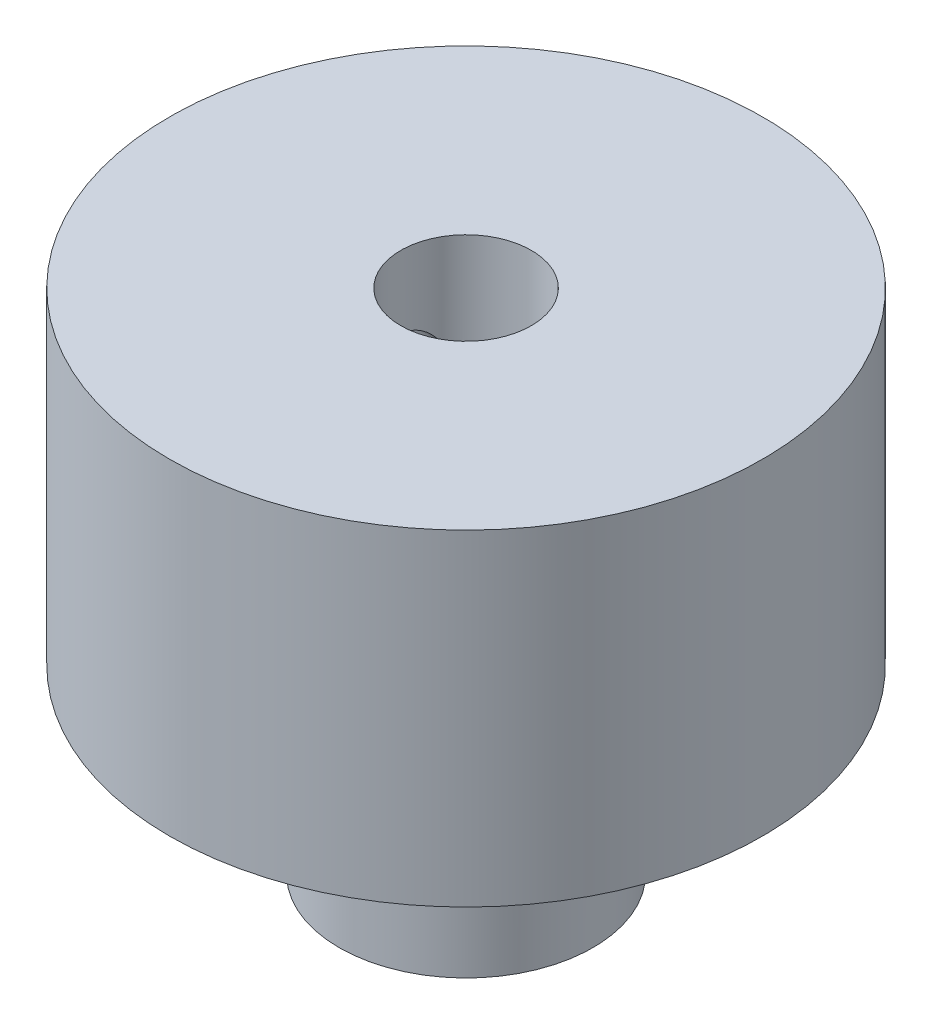
from build123d import *

# Parameters (mm, degrees)
BOSS_EXTRUDE1_DEPTH      = 6
BOSS_EXTRUDE1_DEPTH_BACK = 3
SKETCH1_R                = 8.175
SKETCH1_R_2              = 1.8
SKETCH1_3_R              = 8.175
SKETCH1_3_R_2            = 1.8
BOSS_EXTRUDE2_DEPTH      = 3
SKETCH2_R                = 1
CUT_EXTRUDE1_DEPTH       = 15
SKETCH4_R                = 3.5
BOSS_EXTRUDE3_DEPTH      = 5
SKETCH1_7_R              = 1.8
CUT_EXTRUDE2_DEPTH       = 13


with BuildPart() as part:
    # Sketch1 → Boss-Extrude1 (new, two sides: drawn at the far end of the back side and taken through both)
    with BuildSketch(Plane(origin=(0, 0, 0), x_dir=(1, 0, 0), z_dir=(0, 1, 0)).offset(-BOSS_EXTRUDE1_DEPTH_BACK)):
        Circle(SKETCH1_R)
        Circle(SKETCH1_R_2, mode=Mode.SUBTRACT)
    extrude(amount=BOSS_EXTRUDE1_DEPTH + BOSS_EXTRUDE1_DEPTH_BACK)

    # Sketch2 → Cut-Extrude1 (cut)
    with BuildSketch(Plane(origin=(0, 0, 0), x_dir=(0, 0, -1), z_dir=(1, 0, 0))):
        with Locations((0, 3)):
            Circle(SKETCH2_R)
    extrude(amount=-CUT_EXTRUDE1_DEPTH, mode=Mode.SUBTRACT)



with BuildPart() as body_2:
    # Sketch1<3> → Boss-Extrude2 (new body)
    with BuildSketch(Plane(origin=(0, 0, 0), x_dir=(1, 0, 0), z_dir=(0, 1, 0))):
        Circle(SKETCH1_3_R)
        Circle(SKETCH1_3_R_2, mode=Mode.SUBTRACT)
    extrude(amount=-BOSS_EXTRUDE2_DEPTH)


with BuildPart() as part_1:
    add(part.part)

    add(body_2.part)  # Boss-Extrude3 merges body 2
    # Sketch4 → Boss-Extrude3 (add)
    with BuildSketch(Plane.XZ.offset(3)):
        Circle(SKETCH4_R)
    extrude(amount=BOSS_EXTRUDE3_DEPTH)

    # Sketch1<7> → Cut-Extrude2 (cut)
    with BuildSketch(Plane(origin=(0, 0, 0), x_dir=(1, 0, 0), z_dir=(0, 1, 0))):
        Circle(SKETCH1_7_R)
    extrude(amount=-CUT_EXTRUDE2_DEPTH, mode=Mode.SUBTRACT)


solid = part_1.part
